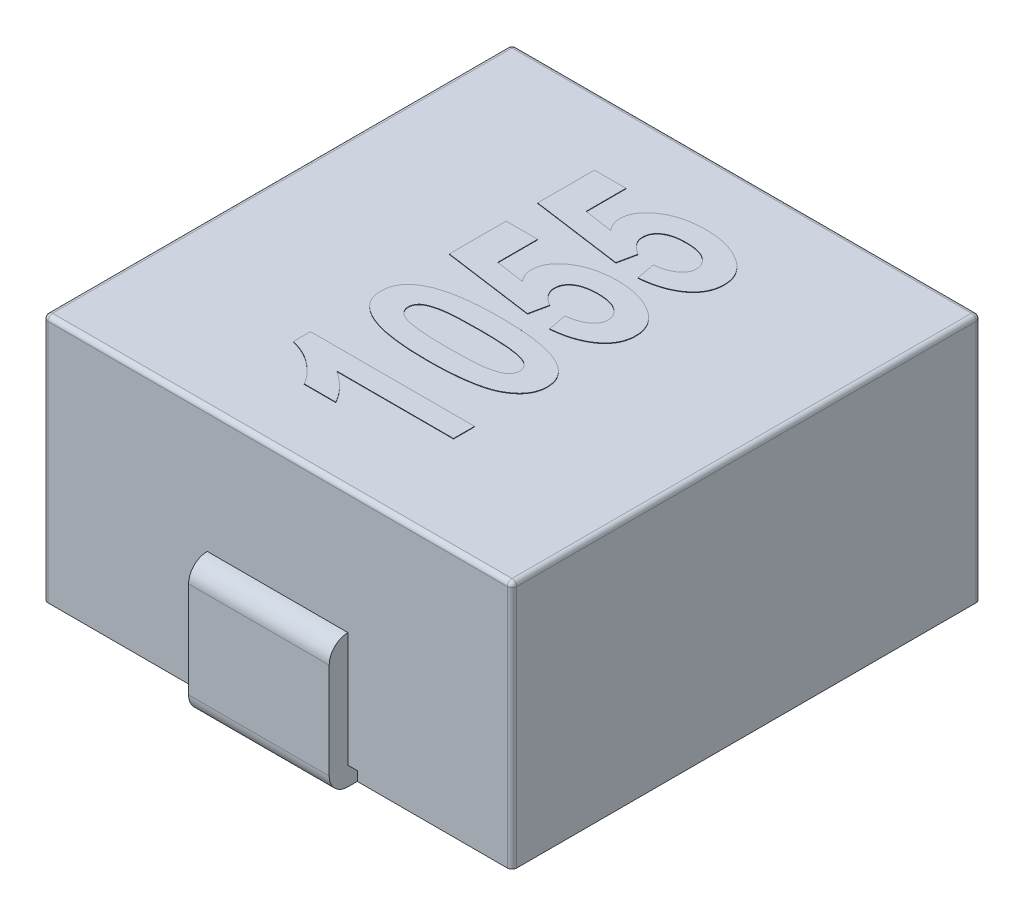
from build123d import *

# Parameters (mm, degrees)
EXTRUDE_1_DEPTH     = 5.3
SKETCH_2_W          = 3.4
SKETCH_2_H          = 2.5
CUT_EXTRUDE_1_DEPTH = 0.2
EXTRUDE_START       = -1.5
EXTRUDE_1_2_DEPTH   = 3
EXTRUDE_2_DEPTH     = 1.5
FILLET_1_R          = 0.1
EXTRUDE_2_2_DEPTH   = 0.01


# Read off the part's stored shape, not the designer's step: Вытянуть-Тонкостенный1
with BuildPart() as part:
    # Эскиз1 → Extrude 1 (new body)
    with BuildSketch(Plane(origin=(0, 0, 0), x_dir=(1, 0, 0), z_dir=(0, 1, 0))):
        with BuildLine():
            Line((-4.9, -5), (4.9, -5))
            ThreePointArc((4.9, -5), (4.970710678, -4.970710678), (5, -4.9))
            Line((5, -4.9), (5, 4.9))
            ThreePointArc((5, 4.9), (4.970710678, 4.970710678), (4.9, 5))
            Line((4.9, 5), (-4.9, 5))
            ThreePointArc((-4.9, 5), (-4.970710678, 4.970710678), (-5, 4.9))
            Line((-5, 4.9), (-5, -4.9))
            ThreePointArc((-5, -4.9), (-4.970710678, -4.970710678), (-4.9, -5))
        make_face()
    extrude(amount=EXTRUDE_1_DEPTH)

    # Эскиз2 → Вырез-Вытянуть1 (cut)
    with BuildSketch(Plane.XZ):
        with Locations((0, 3.75)):
            Rectangle(SKETCH_2_W, SKETCH_2_H)
        with Locations((0, -3.75)):
            Rectangle(SKETCH_2_W, SKETCH_2_H)
    extrude(amount=-CUT_EXTRUDE_1_DEPTH, mode=Mode.SUBTRACT)

    # Extrude 1 2 outline → Extrude 1 2 (add)
    with BuildSketch(Plane(origin=(0, 0, 0), x_dir=(0, 0, -1), z_dir=(1, 0, 0)).offset(EXTRUDE_START)):
        with BuildLine():
            Line((-5, -0.2), (-2.8, -0.2))
            Line((-2.8, -0.2), (-2.8, 0.2))
            Line((-2.8, 0.2), (-5, 0.2))
            Line((-5, 0.2), (-5, 2.65))
            ThreePointArc((-5, 2.65), (-5.282842712, 2.532842712), (-5.4, 2.25))
            Line((-5.4, 2.25), (-5.4, 0.2))
            ThreePointArc((-5.4, 0.2), (-5.282842712, -0.082842712), (-5, -0.2))
        make_face()
    extrude(amount=EXTRUDE_1_2_DEPTH)

    # Эскиз3<3> → Extrude 2 (add, symmetric)
    with BuildSketch(Plane(origin=(0, 0, 0), x_dir=(0, 0, -1), z_dir=(1, 0, 0))):
        with BuildLine():
            ThreePointArc((5, 2.65), (5.282842712, 2.532842712), (5.4, 2.25))
            Line((5.4, 2.25), (5.4, 0.2))
            ThreePointArc((5.4, 0.2), (5.282842712, -0.082842712), (5, -0.2))
            Line((5, -0.2), (2.8, -0.2))
            Line((2.8, -0.2), (2.8, 0.1))
            Line((2.8, 0.1), (5, 0.1))
            ThreePointArc((5, 0.1), (5.070710678, 0.129289322), (5.1, 0.2))
            Line((5.1, 0.2), (5.1, 2.25))
            ThreePointArc((5.1, 2.25), (5.070710678, 2.320710678), (5, 2.35))
            Line((5, 2.35), (5, 2.65))
        make_face()
    extrude(amount=EXTRUDE_2_DEPTH, both=True)

    # Скругление1
    fillet_1_edges = [part.edges().sort_by_distance(p)[0] for p in [
        (4.970710678, 5.3, 4.970710678),
        (5, 5.3, 0),
        (4.970710678, 5.3, -4.970710678),
        (0, 5.3, -5),
        (-4.970710678, 5.3, -4.970710678),
        (-5, 5.3, 0),
        (-4.970710678, 5.3, 4.970710678),
        (0, 5.3, 5),
    ]]
    fillet(fillet_1_edges, radius=FILLET_1_R)

    # Эскиз4 → Extrude 2 2 (add)
    # profile 1 of 4: a face of its own
    with BuildSketch(Plane(origin=(0, 5.3, 0), x_dir=(1, 0, 0), z_dir=(0, 1, 0))):
        with BuildLine():
            Line((1.7, -2.498717949), (1.7, -2.947435897))
            Line((1.7, -2.947435897), (-0.791786859, -2.947435897))
            add(Edge.make_bspline(
                [(-0.791786859, -2.947435897), (-0.760917125, -2.968112469), (-0.700134047, -3.00882502), (-0.614527269, -3.07524319), (-0.53445385, -3.143745701), (-0.460618296, -3.215124853), (-0.393792818, -3.289974458), (-0.332773702, -3.367275786), (-0.276721317, -3.446776955), (-0.245155308, -3.502907989), (-0.229487179, -3.530769231)],
                knots=[0, 0, 0, 0, 1.088938903, 2.144140856, 3.174129565, 4.177079366, 5.152313026, 6.113193535, 7.063463312, 8, 8, 8, 8], degree=3))
            Line((-0.229487179, -3.530769231), (-0.902564103, -3.530769231))
            add(Edge.make_bspline(
                [(-0.902564103, -3.530769231), (-0.919567376, -3.50035862), (-0.955945248, -3.435296251), (-1.030801377, -3.342112081), (-1.123502255, -3.244271043), (-1.233232584, -3.144696305), (-1.357623279, -3.049941186), (-1.495364475, -2.970397872), (-1.643242288, -2.906927009), (-1.74724769, -2.878447448), (-1.8, -2.864002404)],
                knots=[0, 0, 0, 0, 0.726974399, 1.555334676, 2.488102504, 3.542595408, 4.648227997, 5.748855716, 6.858202954, 8, 8, 8, 8], degree=3))
            Line((-1.8, -2.864002404), (-1.8, -2.498717949))
            Line((-1.8, -2.498717949), (1.7, -2.498717949))
        make_face()
    # profile 2 of 4: a face of its own
    with BuildSketch(Plane(origin=(0, 5.3, 0), x_dir=(1, 0, 0), z_dir=(0, 1, 0))):
        with BuildLine():
            add(Edge.make_bspline(
                [(-1.8, -0.995512821), (-1.798971924, -0.966914607), (-1.796956002, -0.910837285), (-1.779600489, -0.829288091), (-1.751216862, -0.752561345), (-1.711795807, -0.68053178), (-1.660204976, -0.613677259), (-1.597284904, -0.552260697), (-1.523884206, -0.494701152), (-1.468794364, -0.462483219), (-1.440324519, -0.445833333)],
                knots=[0, 0, 0, 0, 0.990335955, 1.941918091, 2.874803411, 3.817344592, 4.776447062, 5.790256201, 6.858027893, 8, 8, 8, 8], degree=3))
            add(Edge.make_bspline(
                [(-1.440324519, -0.445833333), (-1.402130188, -0.426528809), (-1.321999388, -0.386028374), (-1.187709872, -0.339590789), (-1.037086157, -0.299060997), (-0.868524307, -0.266712887), (-0.68273044, -0.240885852), (-0.479355206, -0.223434855), (-0.258602274, -0.211834206), (-0.105638786, -0.210795896), (-0.026161859, -0.21025641)],
                knots=[0, 0, 0, 0, 0.709320221, 1.488136996, 2.351578881, 3.296025925, 4.333503578, 5.462459271, 6.681541968, 8, 8, 8, 8], degree=3))
            add(Edge.make_bspline(
                [(-0.026161859, -0.21025641), (0.05307919, -0.210824103), (0.205804784, -0.211918247), (0.426373304, -0.223180419), (0.629445055, -0.241720823), (0.815233625, -0.267561741), (0.984158919, -0.299591623), (1.135426872, -0.340964394), (1.270229966, -0.388247058), (1.350954549, -0.428679187), (1.389403045, -0.447936699)],
                knots=[0, 0, 0, 0, 1.312995247, 2.530607339, 3.658553567, 4.690944312, 5.638052286, 6.505204614, 7.288040485, 8, 8, 8, 8], degree=3))
            add(Edge.make_bspline(
                [(1.389403045, -0.447936699), (1.417671142, -0.464309189), (1.472471595, -0.496048851), (1.544691292, -0.553503235), (1.606822563, -0.6145931), (1.657015487, -0.681370259), (1.697202104, -0.752510236), (1.724221763, -0.829474104), (1.741898473, -0.910808972), (1.743867589, -0.966905045), (1.744871795, -0.995512821)],
                knots=[0, 0, 0, 0, 1.137869452, 2.205870468, 3.208685347, 4.168824794, 5.110097778, 6.045991611, 7.003498256, 8, 8, 8, 8], degree=3))
            add(Edge.make_bspline(
                [(1.744871795, -0.995512821), (1.743647289, -1.02435746), (1.741232778, -1.081234051), (1.722415646, -1.164024254), (1.691837628, -1.242553143), (1.648669918, -1.316493961), (1.592807152, -1.385973125), (1.525230581, -1.451243689), (1.444998856, -1.511405076), (1.352901786, -1.568459546), (1.244441004, -1.619407144), (1.11768181, -1.66292085), (0.972198631, -1.699536647), (0.807708267, -1.729243129), (0.624476212, -1.752718041), (0.422108091, -1.769158929), (0.200862075, -1.778778331), (0.046998564, -1.780087223), (-0.033173077, -1.780769231)],
                knots=[0, 0, 0, 0, 0.645419361, 1.272654235, 1.890740253, 2.526238705, 3.181721312, 3.881207095, 4.624357118, 5.423188913, 6.303383115, 7.301411888, 8.41965395, 9.659608738, 11.042235928, 12.55465667, 14.204780156, 16, 16, 16, 16], degree=3))
            add(Edge.make_bspline(
                [(-0.033173077, -1.780769231), (-0.11194653, -1.780197023), (-0.263970923, -1.779092722), (-0.483607597, -1.767859218), (-0.686203027, -1.749246189), (-0.871542045, -1.723533427), (-1.040001609, -1.691454057), (-1.190755447, -1.649942427), (-1.325360919, -1.60278803), (-1.40608364, -1.562349502), (-1.44453125, -1.543088942)],
                knots=[0, 0, 0, 0, 1.309014685, 2.526259242, 3.653591092, 4.688959007, 5.634987019, 6.500893979, 7.285987363, 8, 8, 8, 8], degree=3))
            add(Edge.make_bspline(
                [(-1.44453125, -1.543088942), (-1.472799347, -1.526716452), (-1.5275998, -1.49497679), (-1.599819497, -1.437522406), (-1.661950768, -1.376432541), (-1.712143692, -1.309655382), (-1.75233031, -1.238515405), (-1.779349968, -1.161551537), (-1.797026678, -1.080216669), (-1.798995794, -1.024120596), (-1.8, -0.995512821)],
                knots=[0, 0, 0, 0, 1.137869452, 2.205870468, 3.208685347, 4.168824794, 5.110097778, 6.045991611, 7.003498256, 8, 8, 8, 8], degree=3))
        make_face()
        with BuildLine():
            add(Edge.make_bspline(
                [(-1.216666667, -0.995512821), (-1.215745048, -1.011064921), (-1.213932015, -1.04165943), (-1.198592912, -1.085849333), (-1.175563122, -1.127727203), (-1.141105366, -1.166499217), (-1.095196075, -1.202564571), (-1.033535276, -1.231690175), (-0.958865183, -1.259259208), (-0.90299898, -1.271968185), (-0.873116987, -1.278766026)],
                knots=[0, 0, 0, 0, 0.768301419, 1.511423193, 2.293981631, 3.122697422, 4.062851431, 5.165553188, 6.483896945, 8, 8, 8, 8], degree=3))
            add(Edge.make_bspline(
                [(-0.873116987, -1.278766026), (-0.850489284, -1.283227388), (-0.801716589, -1.292843594), (-0.722497454, -1.302581659), (-0.632508873, -1.311745177), (-0.53199064, -1.319433689), (-0.420695738, -1.324764299), (-0.298921694, -1.328880254), (-0.166167262, -1.331891109), (-0.074073691, -1.331996469), (-0.026161859, -1.332051282)],
                knots=[0, 0, 0, 0, 0.651153801, 1.403524111, 2.252701802, 3.205906422, 4.250081423, 5.399207061, 6.646933174, 8, 8, 8, 8], degree=3))
            add(Edge.make_bspline(
                [(-0.026161859, -1.332051282), (0.021514143, -1.33189763), (0.112898246, -1.331603115), (0.244041035, -1.329914246), (0.363439623, -1.3251569), (0.471494413, -1.321015869), (0.567740405, -1.313545311), (0.652482366, -1.306466714), (0.725446448, -1.296648014), (0.804835862, -1.282407671), (0.887789499, -1.261179959), (0.971876078, -1.233147142), (1.038054201, -1.202400204), (1.086750785, -1.166568236), (1.119905282, -1.126602127), (1.144729121, -1.086108629), (1.158506538, -1.041466318), (1.160515076, -1.011023821), (1.161538462, -0.995512821)],
                knots=[0, 0, 0, 0, 1.719125493, 3.295174371, 4.728653729, 6.027749307, 7.193722427, 8.209200284, 9.093511833, 9.847244241, 11.116477919, 12.177140384, 13.040196904, 13.737959363, 14.33574092, 14.902295054, 15.440699572, 16, 16, 16, 16], degree=3))
            add(Edge.make_bspline(
                [(1.161538462, -0.995512821), (1.160577401, -0.979975441), (1.158673007, -0.949187265), (1.143818537, -0.904778467), (1.120169783, -0.863220107), (1.086038426, -0.824460468), (1.039868021, -0.788612401), (0.978775112, -0.758273931), (0.9035286, -0.732076963), (0.847825036, -0.719171898), (0.817988782, -0.712259615)],
                knots=[0, 0, 0, 0, 0.768082461, 1.5219978, 2.294253708, 3.122733322, 4.062619397, 5.170279042, 6.484329019, 8, 8, 8, 8], degree=3))
            add(Edge.make_bspline(
                [(0.817988782, -0.712259615), (0.795360282, -0.707804259), (0.746813222, -0.698245763), (0.668074327, -0.688425668), (0.578783186, -0.67928305), (0.478734389, -0.671562497), (0.367670477, -0.666266981), (0.24589698, -0.662143775), (0.113376054, -0.659139874), (0.021516239, -0.659030913), (-0.026161859, -0.658974359)],
                knots=[0, 0, 0, 0, 0.653300683, 1.401587671, 2.246977283, 3.196722021, 4.244339712, 5.397254066, 6.649093985, 8, 8, 8, 8], degree=3))
            add(Edge.make_bspline(
                [(-0.026161859, -0.658974359), (-0.07383798, -0.659126054), (-0.165222309, -0.659416818), (-0.296597117, -0.661134313), (-0.416233946, -0.665825095), (-0.524510809, -0.670097668), (-0.621045787, -0.67722813), (-0.705934378, -0.685432537), (-0.779183469, -0.695011318), (-0.858252134, -0.70939426), (-0.941146101, -0.729727286), (-1.025035447, -0.758082591), (-1.091786848, -0.78859803), (-1.140967216, -0.824533807), (-1.17527507, -0.863963888), (-1.19878456, -0.90529264), (-1.213900248, -0.949386128), (-1.215734342, -0.979967433), (-1.216666667, -0.995512821)],
                knots=[0, 0, 0, 0, 1.716384617, 3.289920733, 4.729522976, 6.026547351, 7.190661509, 8.213695098, 9.09659675, 9.84912745, 11.106129692, 12.165101096, 13.03434735, 13.737722059, 14.340040505, 14.901483381, 15.441591289, 16, 16, 16, 16], degree=3))
        make_face(mode=Mode.SUBTRACT)
    # profile 3 of 4: a face of its own
    with BuildSketch(Plane(origin=(0, 5.3, 0), x_dir=(1, 0, 0), z_dir=(0, 1, 0))):
        with BuildLine():
            Line((0.698798077, 0.103846154), (0.623076923, 0.507692308))
            add(Edge.make_bspline(
                [(0.623076923, 0.507692308), (0.662510765, 0.51206194), (0.737762757, 0.520400554), (0.843279844, 0.548187818), (0.93640491, 0.585698621), (1.015655737, 0.633873055), (1.080151174, 0.689101484), (1.126254596, 0.75067691), (1.156469728, 0.816637611), (1.159849718, 0.863089391), (1.161538462, 0.886298077)],
                knots=[0, 0, 0, 0, 1.32485903, 2.52824166, 3.635317817, 4.669790545, 5.616476441, 6.454055666, 7.227600405, 8, 8, 8, 8], degree=3))
            add(Edge.make_bspline(
                [(1.161538462, 0.886298077), (1.159947709, 0.912522766), (1.156810703, 0.964238551), (1.126372866, 1.037828681), (1.077863325, 1.104137697), (1.023420011, 1.15240394), (0.971239323, 1.185915467), (0.926991192, 1.209496844), (0.877394536, 1.228180782), (0.82311217, 1.243303919), (0.764218222, 1.256340123), (0.700342793, 1.263927401), (0.632081248, 1.27021852), (0.584999904, 1.270412571), (0.560677083, 1.270512821)],
                knots=[0, 0, 0, 0, 1.182316217, 2.331559126, 3.544157708, 4.877807205, 5.596725262, 6.349113227, 7.142834557, 7.990028901, 8.898854619, 9.869895205, 10.899560787, 12, 12, 12, 12], degree=3))
            add(Edge.make_bspline(
                [(0.560677083, 1.270512821), (0.537761116, 1.270343607), (0.493507617, 1.270016835), (0.429191004, 1.264676135), (0.369374068, 1.257572532), (0.313850631, 1.24613595), (0.262966029, 1.231627747), (0.216326837, 1.213981497), (0.173781498, 1.193824768), (0.124877318, 1.162822565), (0.072981516, 1.118412045), (0.027454592, 1.054762786), (-6.5162e-05, 0.98234584), (-0.003409404, 0.931408198), (-0.005128205, 0.905228365)],
                knots=[0, 0, 0, 0, 1.093140475, 2.110986251, 3.077886679, 3.965868566, 4.812993343, 5.600071298, 6.34326131, 7.054906244, 8.35894766, 9.574994785, 10.753648052, 12, 12, 12, 12], degree=3))
            add(Edge.make_bspline(
                [(-0.005128205, 0.905228365), (-0.004300464, 0.888560793), (-0.002633085, 0.854986074), (0.01045745, 0.805607366), (0.032147015, 0.757794281), (0.061916356, 0.711318611), (0.100267476, 0.66623602), (0.147263602, 0.622851446), (0.201743941, 0.579770205), (0.242782041, 0.554483404), (0.264102564, 0.541346154)],
                knots=[0, 0, 0, 0, 0.843790349, 1.69970913, 2.569039925, 3.495457281, 4.487092462, 5.559445776, 6.732058955, 8, 8, 8, 8], degree=3))
            Line((0.264102564, 0.541346154), (0.181370192, 0.148717949))
            Line((0.181370192, 0.148717949), (-1.755128205, 0.417948718))
            Line((-1.755128205, 0.417948718), (-1.755128205, 1.629487179))
            Line((-1.755128205, 1.629487179), (-1.082051282, 1.629487179))
            Line((-1.082051282, 1.629487179), (-1.082051282, 0.777624199))
            Line((-1.082051282, 0.777624199), (-0.465765224, 0.687880609))
            add(Edge.make_bspline(
                [(-0.465765224, 0.687880609), (-0.484688609, 0.712773699), (-0.520987761, 0.760524039), (-0.558830606, 0.839189446), (-0.583939073, 0.917947094), (-0.586968479, 0.971421351), (-0.588461538, 0.997776442)],
                knots=[0, 0, 0, 0, 1.10216519, 2.114191635, 3.070568627, 4, 4, 4, 4], degree=3))
            add(Edge.make_bspline(
                [(-0.588461538, 0.997776442), (-0.587528033, 1.022390038), (-0.585670725, 1.071361406), (-0.57044805, 1.143134913), (-0.545831132, 1.212239331), (-0.510011906, 1.277581989), (-0.465494288, 1.340547542), (-0.410900305, 1.400598438), (-0.345905605, 1.456935181), (-0.272624763, 1.510977732), (-0.190984264, 1.559459247), (-0.10301637, 1.602270195), (-0.009369485, 1.639085154), (0.09049536, 1.668051101), (0.196056357, 1.691529811), (0.30766857, 1.707094887), (0.424941074, 1.717199298), (0.505032819, 1.718543822), (0.545953526, 1.719230769)],
                knots=[0, 0, 0, 0, 0.795031498, 1.581799798, 2.360876835, 3.158596013, 3.982398318, 4.848883208, 5.774943613, 6.758656057, 7.788710285, 8.839528681, 9.918407421, 11.037153655, 12.197497868, 13.411239022, 14.677342756, 16, 16, 16, 16], degree=3))
            add(Edge.make_bspline(
                [(0.545953526, 1.719230769), (0.580556073, 1.718650307), (0.648678691, 1.717507542), (0.749581976, 1.709693211), (0.847475902, 1.696567242), (0.942760323, 1.677485045), (1.034981173, 1.653012492), (1.124683281, 1.623380395), (1.211459996, 1.588714679), (1.267110229, 1.561148168), (1.294751603, 1.547455929)],
                knots=[0, 0, 0, 0, 1.070520798, 2.107552375, 3.12911732, 4.124580663, 5.112002231, 6.079202515, 7.045943225, 8, 8, 8, 8], degree=3))
            add(Edge.make_bspline(
                [(1.294751603, 1.547455929), (1.330243126, 1.527604541), (1.398879627, 1.489214252), (1.491325708, 1.421913575), (1.569039474, 1.348238967), (1.634615109, 1.27014109), (1.683690409, 1.184368056), (1.719293911, 1.093483584), (1.741044028, 0.996926024), (1.743580735, 0.930581178), (1.744871795, 0.896814904)],
                knots=[0, 0, 0, 0, 1.167112315, 2.257060208, 3.27298707, 4.23625639, 5.174393745, 6.096625416, 7.031275662, 8, 8, 8, 8], degree=3))
            add(Edge.make_bspline(
                [(1.744871795, 0.896814904), (1.744155134, 0.869647056), (1.742749738, 0.81637001), (1.728945991, 0.738407295), (1.70652112, 0.664499173), (1.675128076, 0.59414355), (1.635410393, 0.527330144), (1.585331964, 0.465401057), (1.527476063, 0.406720269), (1.460961896, 0.352573803), (1.387335008, 0.302738509), (1.306863962, 0.258636212), (1.220349622, 0.219366991), (1.127830488, 0.185087078), (1.029202853, 0.156240552), (0.924401723, 0.133522712), (0.813767057, 0.114916887), (0.737652248, 0.107587547), (0.698798077, 0.103846154)],
                knots=[0, 0, 0, 0, 0.899008734, 1.762985756, 2.612559822, 3.451062196, 4.308531939, 5.178829944, 6.081860959, 7.03321815, 8.014242136, 9.022339958, 10.068349347, 11.158113059, 12.287185379, 13.468350159, 14.707673859, 16, 16, 16, 16], degree=3))
        make_face()
    # profile 4 of 4: a face of its own
    with BuildSketch(Plane(origin=(0, 5.3, 0), x_dir=(1, 0, 0), z_dir=(0, 1, 0))):
        with BuildLine():
            Line((0.698798077, 1.988461538), (0.623076923, 2.392307692))
            add(Edge.make_bspline(
                [(0.623076923, 2.392307692), (0.662510765, 2.396677325), (0.737762757, 2.405015938), (0.843279844, 2.432803202), (0.93640491, 2.470314006), (1.015655737, 2.518488439), (1.080151174, 2.573716869), (1.126254596, 2.635292295), (1.156469728, 2.701252996), (1.159849718, 2.747704776), (1.161538462, 2.770913462)],
                knots=[0, 0, 0, 0, 1.32485903, 2.52824166, 3.635317817, 4.669790545, 5.616476441, 6.454055666, 7.227600405, 8, 8, 8, 8], degree=3))
            add(Edge.make_bspline(
                [(1.161538462, 2.770913462), (1.159947709, 2.79713815), (1.156810703, 2.848853936), (1.126372866, 2.922444065), (1.077863325, 2.988753082), (1.023420011, 3.037019325), (0.971239323, 3.070530852), (0.926991192, 3.094112229), (0.877394536, 3.112796166), (0.82311217, 3.127919304), (0.764218222, 3.140955508), (0.700342793, 3.148542786), (0.632081248, 3.154833905), (0.584999904, 3.155027956), (0.560677083, 3.155128205)],
                knots=[0, 0, 0, 0, 1.182316217, 2.331559126, 3.544157708, 4.877807205, 5.596725262, 6.349113227, 7.142834557, 7.990028901, 8.898854619, 9.869895205, 10.899560787, 12, 12, 12, 12], degree=3))
            add(Edge.make_bspline(
                [(0.560677083, 3.155128205), (0.537761116, 3.154958992), (0.493507617, 3.15463222), (0.429191004, 3.149291519), (0.369374068, 3.142187916), (0.313850631, 3.130751335), (0.262966029, 3.116243132), (0.216326837, 3.098596881), (0.173781498, 3.078440152), (0.124877318, 3.04743795), (0.072981516, 3.003027429), (0.027454592, 2.93937817), (-6.5162e-05, 2.866961225), (-0.003409404, 2.816023582), (-0.005128205, 2.78984375)],
                knots=[0, 0, 0, 0, 1.093140475, 2.110986251, 3.077886679, 3.965868566, 4.812993343, 5.600071298, 6.34326131, 7.054906244, 8.35894766, 9.574994785, 10.753648052, 12, 12, 12, 12], degree=3))
            add(Edge.make_bspline(
                [(-0.005128205, 2.78984375), (-0.004300464, 2.773176178), (-0.002633085, 2.739601459), (0.01045745, 2.690222751), (0.032147015, 2.642409665), (0.061916356, 2.595933996), (0.100267476, 2.550851405), (0.147263602, 2.507466831), (0.201743941, 2.46438559), (0.242782041, 2.439098789), (0.264102564, 2.425961538)],
                knots=[0, 0, 0, 0, 0.843790349, 1.69970913, 2.569039925, 3.495457281, 4.487092462, 5.559445776, 6.732058955, 8, 8, 8, 8], degree=3))
            Line((0.264102564, 2.425961538), (0.181370192, 2.033333333))
            Line((0.181370192, 2.033333333), (-1.755128205, 2.302564103))
            Line((-1.755128205, 2.302564103), (-1.755128205, 3.514102564))
            Line((-1.755128205, 3.514102564), (-1.082051282, 3.514102564))
            Line((-1.082051282, 3.514102564), (-1.082051282, 2.662239583))
            Line((-1.082051282, 2.662239583), (-0.465765224, 2.572495994))
            add(Edge.make_bspline(
                [(-0.465765224, 2.572495994), (-0.484688609, 2.597389083), (-0.520987761, 2.645139423), (-0.558830606, 2.723804831), (-0.583939073, 2.802562479), (-0.586968479, 2.856036735), (-0.588461538, 2.882391827)],
                knots=[0, 0, 0, 0, 1.10216519, 2.114191635, 3.070568627, 4, 4, 4, 4], degree=3))
            add(Edge.make_bspline(
                [(-0.588461538, 2.882391827), (-0.587528033, 2.907005422), (-0.585670725, 2.955976791), (-0.57044805, 3.027750298), (-0.545831132, 3.096854715), (-0.510011906, 3.162197374), (-0.465494288, 3.225162926), (-0.410900305, 3.285213823), (-0.345905605, 3.341550566), (-0.272624763, 3.395593116), (-0.190984264, 3.444074632), (-0.10301637, 3.48688558), (-0.009369485, 3.523700538), (0.09049536, 3.552666485), (0.196056357, 3.576145195), (0.30766857, 3.591710271), (0.424941074, 3.601814683), (0.505032819, 3.603159206), (0.545953526, 3.603846154)],
                knots=[0, 0, 0, 0, 0.795031498, 1.581799798, 2.360876835, 3.158596013, 3.982398318, 4.848883208, 5.774943613, 6.758656057, 7.788710285, 8.839528681, 9.918407421, 11.037153655, 12.197497868, 13.411239022, 14.677342756, 16, 16, 16, 16], degree=3))
            add(Edge.make_bspline(
                [(0.545953526, 3.603846154), (0.580556073, 3.603265692), (0.648678691, 3.602122926), (0.749581976, 3.594308595), (0.847475902, 3.581182626), (0.942760323, 3.562100429), (1.034981173, 3.537627877), (1.124683281, 3.50799578), (1.211459996, 3.473330063), (1.267110229, 3.445763552), (1.294751603, 3.432071314)],
                knots=[0, 0, 0, 0, 1.070520798, 2.107552375, 3.12911732, 4.124580663, 5.112002231, 6.079202515, 7.045943225, 8, 8, 8, 8], degree=3))
            add(Edge.make_bspline(
                [(1.294751603, 3.432071314), (1.330243126, 3.412219925), (1.398879627, 3.373829636), (1.491325708, 3.30652896), (1.569039474, 3.232854352), (1.634615109, 3.154756474), (1.683690409, 3.068983441), (1.719293911, 2.978098969), (1.741044028, 2.881541409), (1.743580735, 2.815196562), (1.744871795, 2.781430288)],
                knots=[0, 0, 0, 0, 1.167112315, 2.257060208, 3.27298707, 4.23625639, 5.174393745, 6.096625416, 7.031275662, 8, 8, 8, 8], degree=3))
            add(Edge.make_bspline(
                [(1.744871795, 2.781430288), (1.744155134, 2.75426244), (1.742749738, 2.700985394), (1.728945991, 2.62302268), (1.70652112, 2.549114557), (1.675128076, 2.478758935), (1.635410393, 2.411945528), (1.585331964, 2.350016441), (1.527476063, 2.291335654), (1.460961896, 2.237189188), (1.387335008, 2.187353893), (1.306863962, 2.143251597), (1.220349622, 2.103982376), (1.127830488, 2.069702463), (1.029202853, 2.040855937), (0.924401723, 2.018138097), (0.813767057, 1.999532272), (0.737652248, 1.992202932), (0.698798077, 1.988461538)],
                knots=[0, 0, 0, 0, 0.899008734, 1.762985756, 2.612559822, 3.451062196, 4.308531939, 5.178829944, 6.081860959, 7.03321815, 8.014242136, 9.022339958, 10.068349347, 11.158113059, 12.287185379, 13.468350159, 14.707673859, 16, 16, 16, 16], degree=3))
        make_face()
    extrude(amount=EXTRUDE_2_2_DEPTH)


solid = part.part
